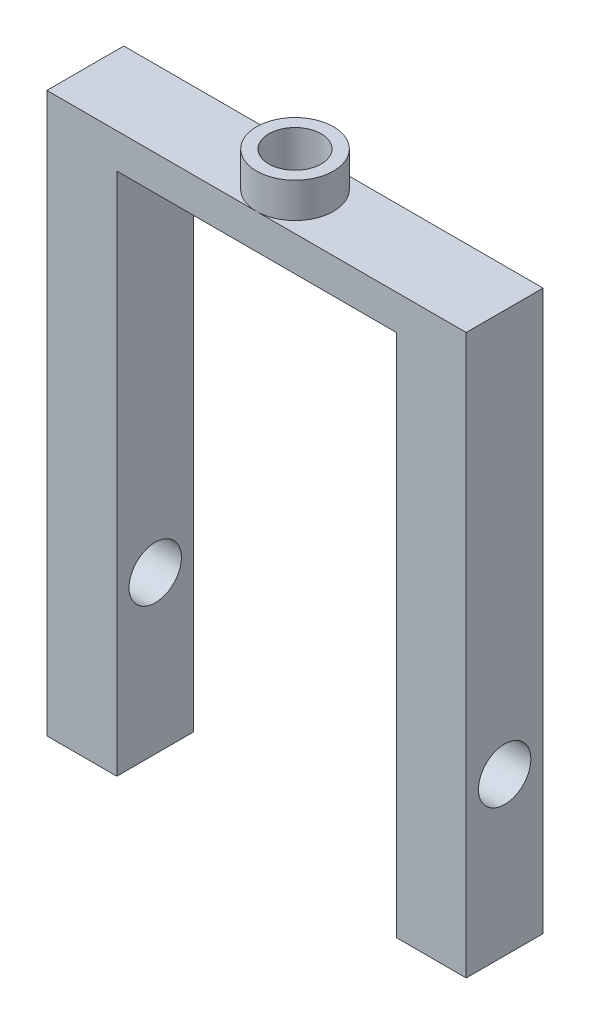
from build123d import *

# Parameters (mm, degrees)
SKETCH1_R               = 6.985
BOSS_EXTRUDE1_DEPTH     = 6.35
SKETCH3_R               = 4.7625
CUT_EXTRUDE1_DEPTH      = 63.5
SKETCH5_W               = 76.2
SKETCH5_H               = 13.97
BOSS_EXTRUDE2_DEPTH     = 101.6
SKETCH6_W               = 50.8
SKETCH6_H               = 95.25
CUT_EXTRUDE2_DEPTH      = 116.325510621
SKETCH7_R               = 4.7625
CUT_EXTRUDE3_DEPTH      = 115.689156964
CUT_EXTRUDE4_DEPTH      = 126.436209784
CUT_EXTRUDE4_DEPTH_BACK = 19.05
SKETCH8_R               = 4.7625


with BuildPart() as part:
    # Sketch1 → Boss-Extrude1 (new body)
    with BuildSketch(Plane(origin=(0, 0, 0), x_dir=(1, 0, 0), z_dir=(0, 1, 0))):
        Circle(SKETCH1_R)
    extrude(amount=-BOSS_EXTRUDE1_DEPTH)

    # Sketch3 → Cut-Extrude1 (cut)
    with BuildSketch(Plane(origin=(0, 0, 0), x_dir=(1, 0, 0), z_dir=(0, 1, 0))):
        Circle(SKETCH3_R)
    extrude(amount=-CUT_EXTRUDE1_DEPTH, mode=Mode.SUBTRACT)

    # Sketch5 → Boss-Extrude2 (add)
    with BuildSketch(Plane(origin=(0, -6.35, 0), x_dir=(-1, 0, 0), z_dir=(0, -1, 0))):
        Rectangle(SKETCH5_W, SKETCH5_H)
    extrude(amount=BOSS_EXTRUDE2_DEPTH)

    # Sketch6 → Cut-Extrude2 (cut, through all)
    with BuildSketch(Plane(origin=(0, 0, -6.985), x_dir=(-1, 0, 0), z_dir=(0, 0, -1))):
        with Locations((0, -60.325)):
            Rectangle(SKETCH6_W, SKETCH6_H)
    extrude(amount=-CUT_EXTRUDE2_DEPTH, mode=Mode.SUBTRACT)

    # Sketch7 → Cut-Extrude3 (cut, through all)
    with BuildSketch(Plane(origin=(0, 0, 0), x_dir=(1, 0, 0), z_dir=(0, 1, 0))):
        Circle(SKETCH7_R)
    extrude(amount=-CUT_EXTRUDE3_DEPTH, mode=Mode.SUBTRACT)

    # Sketch8 → Cut-Extrude4 (cut, two sides: drawn at the far end of the back side and taken through both)
    with BuildSketch(Plane.ZY.offset(-25.4).offset(-CUT_EXTRUDE4_DEPTH_BACK)):
        with Locations((0, -79.375)):
            Circle(SKETCH8_R)
    extrude(amount=CUT_EXTRUDE4_DEPTH + CUT_EXTRUDE4_DEPTH_BACK, mode=Mode.SUBTRACT)


solid = part.part
